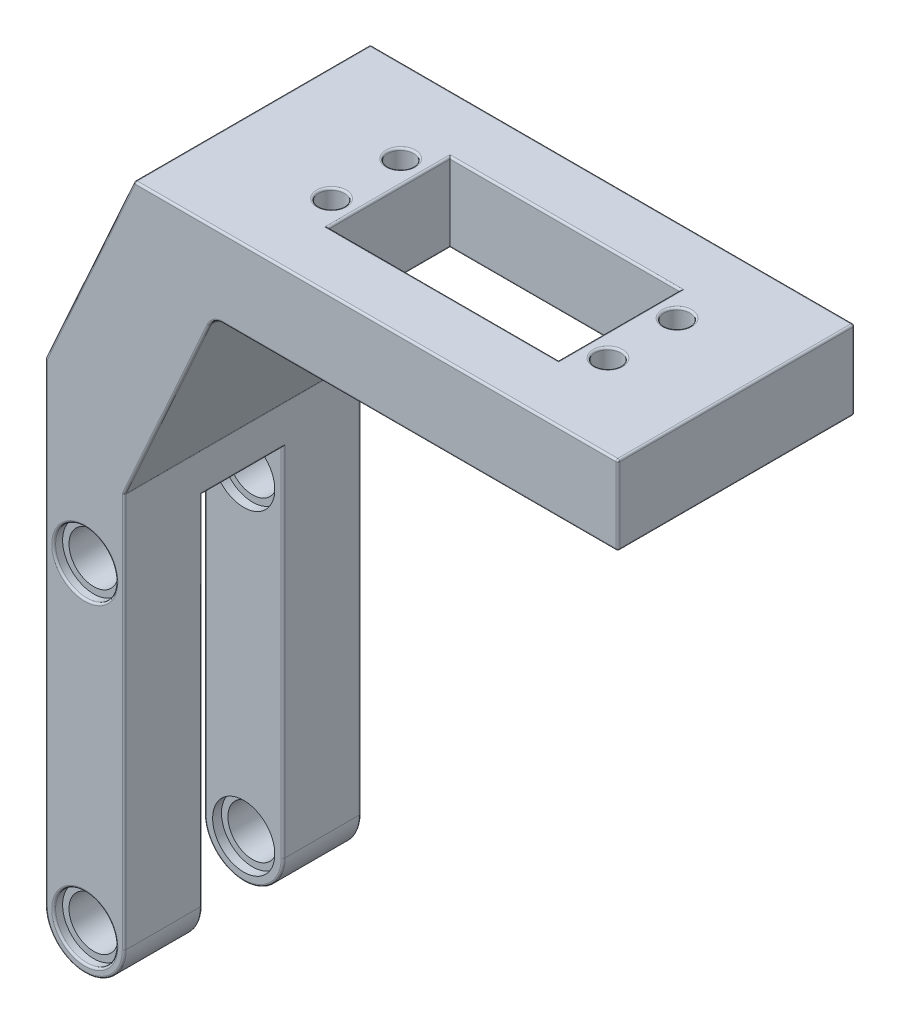
from build123d import *

# Parameters (mm, degrees)
SKETCH_1_W          = 8
SKETCH_1_H          = 72
SKETCH_1_W_2        = 50
SKETCH_1_H_2        = 8
EXTRUDE_1_DEPTH     = 12
SKETCH_2_W          = 8
SKETCH_2_H          = 8.2
CUT_EXTRUDE_1_DEPTH = 40.1
SKETCH_3_R          = 2.5
CUT_EXTRUDE_2_DEPTH = 20.05
SKETCH_4_R          = 3.15
CUT_EXTRUDE_3_DEPTH = 0.9
CUT_EXTRUDE_START   = -7
SKETCH_4_2_R        = 3.15
CUT_EXTRUDE_4_DEPTH = 0.9
CUT_EXTRUDE_START_2 = -16.1
SKETCH_4_3_R        = 3.15
CUT_EXTRUDE_5_DEPTH = 0.9
CUT_EXTRUDE_START_3 = -23.1
SKETCH_4_4_R        = 3.15
CUT_EXTRUDE_6_DEPTH = 0.9
SKETCH_5_W          = 23.3
SKETCH_5_H          = 12.3
CUT_EXTRUDE_7_DEPTH = 8
SKETCH_6_R          = 1.3
CUT_EXTRUDE_8_DEPTH = 8
CHAMFER_1_SIZE      = 20
CHAMFER_1_SIZE2     = 9
CHAMFER_2_SIZE      = 9
CHAMFER_2_SIZE2     = 20
FILLET_4_R          = 1.5
FILLET_2_R          = 4
FILLET_3_R          = 0.2


with BuildPart() as part:
    # 草图1 → 凸台-拉伸1 (new, symmetric)
    with BuildSketch(Plane.XY):
        Rectangle(SKETCH_1_W, SKETCH_1_H)
        with Locations((29, 32)):
            Rectangle(SKETCH_1_W_2, SKETCH_1_H_2)
    extrude(amount=EXTRUDE_1_DEPTH, both=True)

    # 草图2 → 切除-拉伸1 (cut)
    with BuildSketch(Plane.XZ.offset(36)):
        Rectangle(SKETCH_2_W, SKETCH_2_H)
    extrude(amount=-CUT_EXTRUDE_1_DEPTH, mode=Mode.SUBTRACT)

    # 草图3 → 切除-拉伸2 (cut, symmetric)
    with BuildSketch(Plane.XY):
        Circle(SKETCH_3_R)
        with Locations((0, -32)):
            Circle(SKETCH_3_R)
    extrude(amount=CUT_EXTRUDE_2_DEPTH, both=True, mode=Mode.SUBTRACT)

    # 草图4 → 切除-拉伸3 (cut)
    with BuildSketch(Plane.XY.offset(12)):
        Circle(SKETCH_4_R)
        with Locations((0, -32)):
            Circle(SKETCH_4_R)
    extrude(amount=-CUT_EXTRUDE_3_DEPTH, mode=Mode.SUBTRACT)

    # 草图4<2> → 切除-拉伸4 (cut)
    with BuildSketch(Plane.XY.offset(12).offset(CUT_EXTRUDE_START)):
        Circle(SKETCH_4_2_R)
        with Locations((0, -32)):
            Circle(SKETCH_4_2_R)
    extrude(amount=-CUT_EXTRUDE_4_DEPTH, mode=Mode.SUBTRACT)

    # 草图4<3> → 切除-拉伸5 (cut)
    with BuildSketch(Plane.XY.offset(12).offset(CUT_EXTRUDE_START_2)):
        Circle(SKETCH_4_3_R)
        with Locations((0, -32)):
            Circle(SKETCH_4_3_R)
    extrude(amount=-CUT_EXTRUDE_5_DEPTH, mode=Mode.SUBTRACT)

    # 草图4<4> → 切除-拉伸6 (cut)
    with BuildSketch(Plane.XY.offset(12).offset(CUT_EXTRUDE_START_3)):
        Circle(SKETCH_4_4_R)
        with Locations((0, -32)):
            Circle(SKETCH_4_4_R)
    extrude(amount=-CUT_EXTRUDE_6_DEPTH, mode=Mode.SUBTRACT)

    # 草图5 → 切除-拉伸7 (cut)
    with BuildSketch(Plane(origin=(0, 36, 0), x_dir=(1, 0, 0), z_dir=(0, 1, 0))):
        with Locations((30.5, 0)):
            Rectangle(SKETCH_5_W, SKETCH_5_H)
    extrude(amount=-CUT_EXTRUDE_7_DEPTH, mode=Mode.SUBTRACT)

    # 草图6 → 切除-拉伸8 (cut)
    with BuildSketch(Plane.XZ.offset(-28)):
        with Locations((44.5, 3.5)):
            Circle(SKETCH_6_R)
        with Locations((44.5, -3.5)):
            Circle(SKETCH_6_R)
        with Locations((16.5, 3.5)):
            Circle(SKETCH_6_R)
        with Locations((16.5, -3.5)):
            Circle(SKETCH_6_R)
    extrude(amount=-CUT_EXTRUDE_8_DEPTH, mode=Mode.SUBTRACT)

    # 倒角1
    chamfer_1_edges = [part.edges().sort_by_distance(p)[0] for p in [
        (4, 28, 0),
    ]]
    chamfer_1_side = [part.faces().sort_by_distance(p)[0] for p in [
        (4, -35.3164797, -8.05),
    ]]
    chamfer(chamfer_1_edges, length=CHAMFER_1_SIZE, length2=CHAMFER_1_SIZE2, reference=chamfer_1_side[0])

    # 倒角2
    chamfer_2_edges = [part.edges().sort_by_distance(p)[0] for p in [
        (-4, 36, 0),
    ]]
    chamfer_2_side = [part.faces().sort_by_distance(p)[0] for p in [
        (25, 36, -11.372305807),
    ]]
    chamfer(chamfer_2_edges, length=CHAMFER_2_SIZE, length2=CHAMFER_2_SIZE2, reference=chamfer_2_side[0])

    # 圆角4
    fillet_4_edges = [part.edges().sort_by_distance(p)[0] for p in [
        (13, 28, 0),
    ]]
    fillet(fillet_4_edges, radius=FILLET_4_R)

    # 圆角2
    fillet_2_edges = [part.edges().sort_by_distance(p)[0] for p in [
        (-4, -36, 8.05),
        (4, -36, 8.05),
        (-4, -36, -8.05),
        (4, -36, -8.05),
    ]]
    fillet(fillet_2_edges, radius=FILLET_2_R - 0.0001)  # a hair under: the kernel refuses the full size

    # 圆角3
    fillet_3_edges = [part.edges().sort_by_distance(p)[0] for p in [
        (-3.15, 0, -12),
        (-3.15, -32, -12),
        (18.85, 28, 0),
        (30.5, 28, -6.15),
        (42.15, 28, 0),
        (30.5, 28, 6.15),
        (18.85, 36, 0),
        (30.5, 36, 6.15),
        (42.15, 36, 0),
        (30.5, 36, -6.15),
        (54, 36, 0),
        (43.2, 36, -3.5),
        (43.2, 28, -3.5),
        (54, 28, 0),
        (15.2, 36, 3.5),
        (15.2, 28, 3.5),
        (15.2, 36, -3.5),
        (15.2, 28, -3.5),
        (43.2, 36, 3.5),
        (43.2, 28, 3.5),
        (4, 8, 0),
        (8.300998079, 17.557773508, 12),
        (29.5, 36, -12),
        (0.5, 26, -12),
        (29.5, 36, 12),
        (5, 36, 0),
        (0.5, 26, 12),
        (33.984939207, 28, 12),
        (33.984939207, 28, -12),
        (8.300998079, 17.557773508, -12),
        (13.155421702, 27.759627033, -12),
        (13.155421702, 27.759627033, 12),
        (2.828456414, -34.828456414, 4.1),
        (-2.828456414, -34.828456414, 4.1),
        (-4, -8.00005, 12),
        (-4, -8.00005, -12),
        (4, -12.00005, 12),
        (2.828456414, -34.828456414, 12),
        (-2.828456414, -34.828456414, 12),
        (4, -12.00005, -12),
        (2.828456414, -34.828456414, -12),
        (-2.828456414, -34.828456414, -12),
        (2.828456414, -34.828456414, -4.1),
        (-2.828456414, -34.828456414, -4.1),
        (54, 32, 12),
        (4, 4.1, 0),
        (4, -13.95005, 4.1),
        (4, -13.95005, -4.1),
        (-4, -13.95005, -4.1),
        (-4, -13.95005, 4.1),
        (-3.15, 0, 12),
        (-3.15, -32, 12),
        (54, 32, -12),
    ]]
    fillet(fillet_3_edges, radius=FILLET_3_R)


solid = part.part
